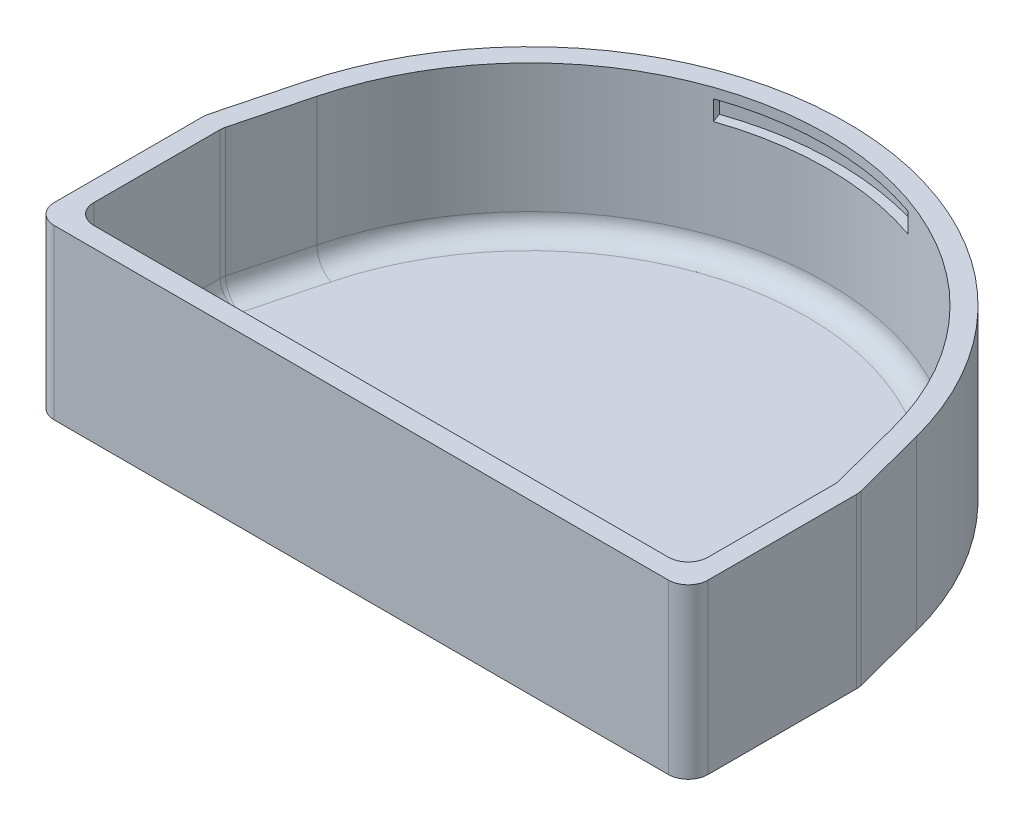
from build123d import *

# Parameters (mm, degrees)
BOSS_EXTRUDE1_DEPTH = 17
SKETCH4_OUTSIDE_W   = 84.788
SKETCH4_OUTSIDE_H   = 67.788
CUT_EXTRUDE1_DEPTH  = 15
FILLET4_R           = 2
FILLET5_R           = 2
SKETCH9_W           = 32
SKETCH9_H           = 2
CUT_EXTRUDE2_DEPTH  = 1
FILLET6_R           = 1
WRAP5_START         = 14
WRAP5_DEPTH         = 2


# Read off the part's stored shape, not the designer's step: Wrap5
with BuildPart() as part:
    # Sketch2 → Boss-Extrude1 (new body)
    with BuildSketch(Plane(origin=(0, 0, 0), x_dir=(1, 0, 0), z_dir=(0, 1, 0))):
        with BuildLine():
            Line((30.967741935, 8.062193214), (33, 0.25607376))
            Line((33, 0.25607376), (33, -17))
            Line((33, -17), (-33, -17))
            Line((-33, -17), (-33, 0.25607376))
            Line((-33, 0.25607376), (-30.967741935, 8.062193214))
            ThreePointArc((-30.967741935, 8.062193214), (0, 32), (30.967741935, 8.062193214))
        make_face()
    extrude(amount=BOSS_EXTRUDE1_DEPTH)

    # Sketch4 outside → Cut-Extrude1 (cut)
    # profile 1 of 2: a face of its own
    with BuildSketch(Plane(origin=(0, 17, 0), x_dir=(1, 0, 0), z_dir=(0, 1, 0))):
        with Locations((0, 7.5)):
            Rectangle(SKETCH4_OUTSIDE_W, SKETCH4_OUTSIDE_H)
        with BuildLine():
            Line((33, -17), (33, 0.25607376))
            Line((33, 0.25607376), (30.967741935, 8.062193214))
            ThreePointArc((30.967741935, 8.062193214), (0, 32), (-30.967741935, 8.062193214))
            Line((-30.967741935, 8.062193214), (-33, 0.25607376))
            Line((-33, 0.25607376), (-33, -17))
            Line((-33, -17), (33, -17))
        make_face(mode=Mode.SUBTRACT)
    # profile 2 of 2: a face of its own
    with BuildSketch(Plane(origin=(0, 17, 0), x_dir=(1, 0, 0), z_dir=(0, 1, 0))):
        with BuildLine():
            Line((-29.032258065, 7.558306138), (-31, 0))
            Line((-31, 0), (-31, -15))
            Line((-31, -15), (31, -15))
            Line((31, -15), (31, 0))
            Line((31, 0), (29.032258065, 7.558306138))
            ThreePointArc((29.032258065, 7.558306138), (0, 30), (-29.032258065, 7.558306138))
        make_face()
    extrude(amount=-CUT_EXTRUDE1_DEPTH, mode=Mode.SUBTRACT)

    # Fillet4
    fillet4_edges = [part.edges().sort_by_distance(p)[0] for p in [
        (33, 8.5, -0.25607376),
        (33, 8.5, 17),
        (-33, 8.5, 17),
        (-33, 8.5, -0.25607376),
        (31, 9.5, 0),
        (31, 9.5, 15),
        (-31, 9.5, 15),
        (-31, 9.5, 0),
    ]]
    fillet(fillet4_edges, radius=FILLET4_R)

    # Fillet5
    fillet5_edges = [part.edges().sort_by_distance(p)[0] for p in [
        (0, 2, -30),
        (-29.983870968, 2, -3.903059727),
        (0, 2, 15),
        (-31, 2, 6.62803688),
        (31, 2, 6.62803688),
        (29.983870968, 2, -3.903059727),
        (-30.983805401, 2, 0.002073506),
        (30.983805401, 2, 0.002073506),
        (30.414213562, 2, 14.414213562),
        (-30.414213562, 2, 14.414213562),
    ]]
    fillet(fillet5_edges, radius=FILLET5_R)

    # Sketch9 → Cut-Extrude2 (cut)
    with BuildSketch(Plane(origin=(0, 0, 15), x_dir=(-1, 0, 0), z_dir=(0, 0, -1))):
        with Locations((0, 15)):
            Rectangle(SKETCH9_W, SKETCH9_H)
    extrude(amount=-CUT_EXTRUDE2_DEPTH, mode=Mode.SUBTRACT)

    # Fillet6
    fillet6_edges = [part.edges().sort_by_distance(p)[0] for p in [
        (0, 16, 16),
    ]]
    fillet(fillet6_edges, radius=FILLET6_R - 0.0001)  # a hair under: the kernel refuses the full size
    fillet6_2_edges = [part.edges().sort_by_distance(p)[0] for p in [
        (-16, 14.50005, 16),
    ]]
    fillet(fillet6_2_edges, radius=FILLET6_R - 0.0001)  # a hair under: the kernel refuses the full size
    fillet6_3_edges = [part.edges().sort_by_distance(p)[0] for p in [
        (0.49995, 14, 16),
    ]]
    fillet(fillet6_3_edges, radius=FILLET6_R - 0.0001)  # a hair under: the kernel refuses the full size
    fillet6_4_edges = [part.edges().sort_by_distance(p)[0] for p in [
        (16, 15, 16),
    ]]
    fillet(fillet6_4_edges, radius=FILLET6_R - 0.0001)  # a hair under: the kernel refuses the full size

    # Wrap5 outline → Wrap5 (cut)
    with BuildSketch(Plane(origin=(0, 0, 0), x_dir=(1, 0, 0), z_dir=(0, 1, 0)).offset(WRAP5_START)):
        with BuildLine():
            Line((9.815840904, 28.348708389), (10.143035601, 29.293665336))
            ThreePointArc((10.143035601, 29.293665336), (0, 31), (-10.143035601, 29.293665336))
            Line((-10.143035601, 29.293665336), (-9.815840904, 28.348708389))
            ThreePointArc((-9.815840904, 28.348708389), (0, 30), (9.815840904, 28.348708389))
        make_face()
    extrude(amount=WRAP5_DEPTH, mode=Mode.SUBTRACT)


solid = part.part
